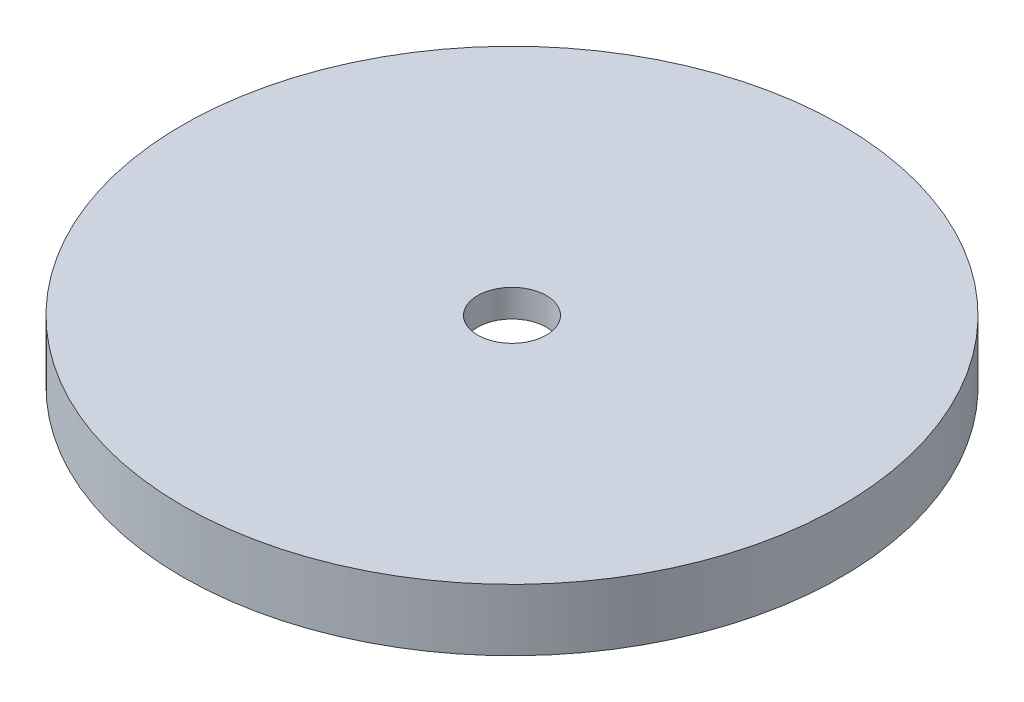
from build123d import *

# Parameters (mm, degrees)
SKETCH1_R           = 24
SKETCH1_R_2         = 19
BOSS_EXTRUDE1_DEPTH = 2.5
SKETCH2_R           = 24
BOSS_EXTRUDE2_DEPTH = 2
SKETCH3_R           = 2.5
CUT_EXTRUDE1_DEPTH  = 35.238136632


with BuildPart() as part:
    # Sketch1 → Boss-Extrude1 (new body)
    with BuildSketch(Plane(origin=(0, 0, 0), x_dir=(1, 0, 0), z_dir=(0, 1, 0))):
        Circle(SKETCH1_R)
        Circle(SKETCH1_R_2, mode=Mode.SUBTRACT)
    extrude(amount=BOSS_EXTRUDE1_DEPTH)

    # Sketch2 → Boss-Extrude2 (add)
    with BuildSketch(Plane(origin=(0, 2.5, 0), x_dir=(1, 0, 0), z_dir=(0, 1, 0))):
        Circle(SKETCH2_R)
    extrude(amount=BOSS_EXTRUDE2_DEPTH)

    # Sketch3 → Cut-Extrude1 (cut, through all)
    with BuildSketch(Plane.XZ):
        Circle(SKETCH3_R)
    extrude(amount=-CUT_EXTRUDE1_DEPTH, mode=Mode.SUBTRACT)


solid = part.part
